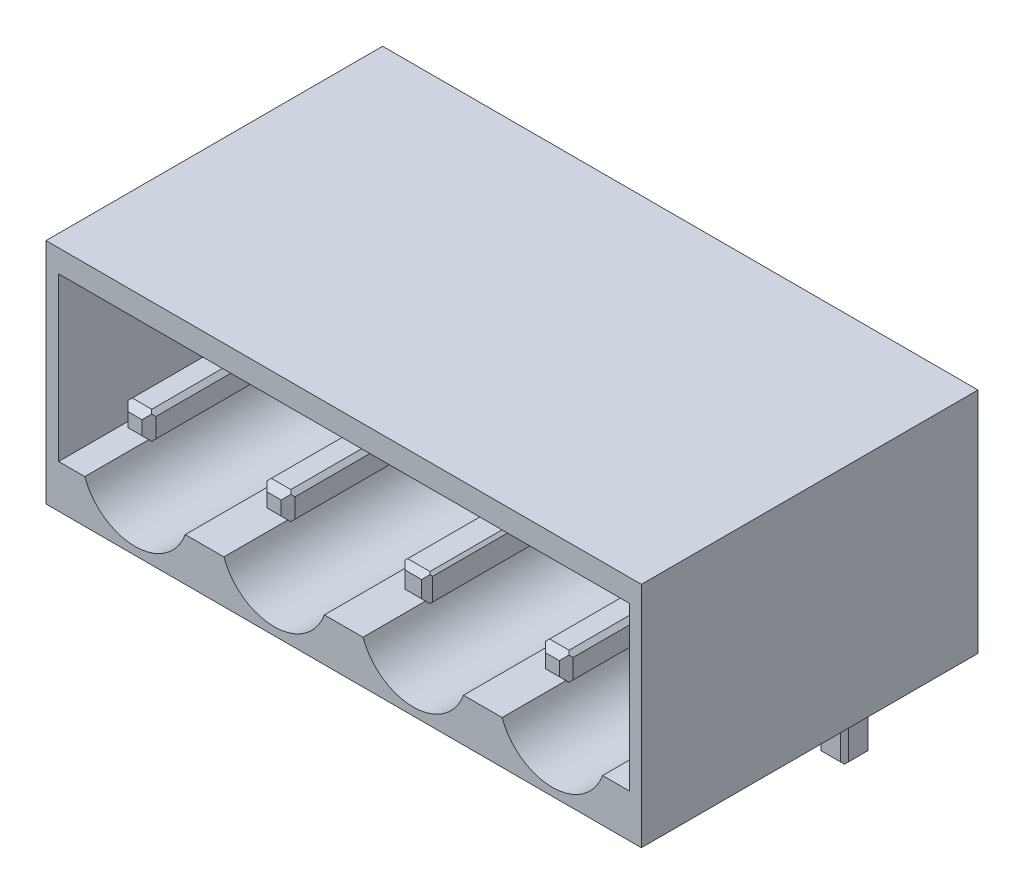
from build123d import *

# Parameters (mm, degrees)
SKETCH_1_W          = 21.4
SKETCH_1_H          = 8.2
EXTRUDE_1_DEPTH     = 12.1
SKETCH_4_R          = 1.25
CUT_EXTRUDE_3_DEPTH = 8
CUT_EXTRUDE_4_DEPTH = 7.8
SKETCH_7_W          = 1
SKETCH_7_H          = 1
EXTRUDE_2_DEPTH     = 8
CHAMFER_1_SIZE      = 0.15
CHAMFER_2_SIZE      = 0.25
SKETCH_8_W          = 1
SKETCH_8_H          = 1
EXTRUDE_3_DEPTH     = 4
CHAMFER_3_SIZE      = 0.15
CHAMFER_4_SIZE      = 0.25
CHAMFER_6_SIZE      = 0.1
CHAMFER_7_SIZE      = 0.2
CHAMFER_8_SIZE      = 0.1
CHAMFER_9_SIZE      = 0.2


with BuildPart() as part:
    # Эскиз1 → Бобышка-Вытянуть1 (new body)
    with BuildSketch(Plane.XY):
        Rectangle(SKETCH_1_W, SKETCH_1_H)
    extrude(amount=EXTRUDE_1_DEPTH)

    # Эскиз4 → Вырез-Вытянуть3 (cut)
    with BuildSketch(Plane.XY.offset(12.1)):
        with Locations((-7.5, 0)):
            Circle(SKETCH_4_R)
        with Locations((-2.5, 0)):
            Circle(SKETCH_4_R)
        with Locations((2.5, 0)):
            Circle(SKETCH_4_R)
        with Locations((7.5, 0)):
            Circle(SKETCH_4_R)
    extrude(amount=-CUT_EXTRUDE_3_DEPTH, mode=Mode.SUBTRACT)

    # Эскиз5 → Вырез-Вытянуть4 (cut)
    with BuildSketch(Plane.XY.offset(12.1)):
        with BuildLine():
            Line((-10.245621634, 0), (-10.245621634, 3.292901982))
            Line((-10.245621634, 3.292901982), (0.278509544, 3.292901982))
            Line((0.278509544, 3.292901982), (5.278509544, 3.292901982))
            Line((5.278509544, 3.292901982), (10.278509544, 3.292901982))
            Line((10.278509544, 3.292901982), (10.278509544, -2.548957219))
            Line((10.278509544, -2.548957219), (9.30582632, -2.548957219))
            ThreePointArc((9.30582632, -2.548957219), (7.5, -3.818893996), (5.69417368, -2.548957219))
            Line((5.69417368, -2.548957219), (4.30582632, -2.548957219))
            ThreePointArc((4.30582632, -2.548957219), (2.5, -3.818893996), (0.69417368, -2.548957219))
            Line((0.69417368, -2.548957219), (-0.69417368, -2.548957219))
            ThreePointArc((-0.69417368, -2.548957219), (-2.5, -3.818893996), (-4.30582632, -2.548957219))
            Line((-4.30582632, -2.548957219), (-5.69417368, -2.548957219))
            ThreePointArc((-5.69417368, -2.548957219), (-7.5, -3.818893996), (-9.30582632, -2.548957219))
            Line((-9.30582632, -2.548957219), (-10.245621634, -2.548957219))
            Line((-10.245621634, -2.548957219), (-10.245621634, 0))
        make_face()
    extrude(amount=-CUT_EXTRUDE_4_DEPTH, mode=Mode.SUBTRACT)

    # Эскиз7 → Бобышка-Вытянуть2 (add)
    with BuildSketch(Plane.XY.offset(4.1)):
        with Locations((-2.5, 0)):
            Rectangle(SKETCH_7_W, SKETCH_7_H)
        with Locations((-7.5, 0)):
            Rectangle(SKETCH_7_W, SKETCH_7_H)
        with Locations((2.5, 0)):
            Rectangle(SKETCH_7_W, SKETCH_7_H)
        with Locations((7.5, 0)):
            Rectangle(SKETCH_7_W, SKETCH_7_H)
    extrude(amount=EXTRUDE_2_DEPTH)

    # Фаска1
    chamfer_1_edges = [part.edges().sort_by_distance(p)[0] for p in [
        (-7, -0.5, 8.1),
        (-7, 0.5, 8.1),
        (-8, 0.5, 8.1),
        (-8, -0.5, 8.1),
        (-2, -0.5, 8.1),
        (-2, 0.5, 8.1),
        (-3, 0.5, 8.1),
        (-3, -0.5, 8.1),
    ]]
    chamfer(chamfer_1_edges, length=CHAMFER_1_SIZE)

    # Фаска2
    # the kernel refuses this chamfer: 0.25 mm, written as the material it takes off along each edge
    with BuildSketch(Plane(origin=(-3, -0.992920747, 12.1), x_dir=(-0.02749587661058555, 0, -0.9996219169112968), z_dir=(0, 1, 0)), Plane(origin=(-3.492920747, 0.5, 12.1), x_dir=(0, 0.027495876610586414, -0.9996219169112968), z_dir=(1, 0, 0)), Plane(origin=(-2, 0.992920747, 12.1), x_dir=(0.027495876610586414, 0, -0.9996219169112968), z_dir=(0, -1, 0)), Plane(origin=(-1.507079253, -0.5, 12.1), x_dir=(0, -0.027495876610586414, -0.9996219169112968), z_dir=(-1, 0, 0)), Plane(origin=(-7, 0.992920747, 12.1), x_dir=(0.02749587661058555, 0, -0.9996219169112968), z_dir=(0, -1, 0)), Plane(origin=(-6.507079253, -0.5, 12.1), x_dir=(0, -0.027495876610586414, -0.9996219169112968), z_dir=(-1, 0, 0)), Plane(origin=(-8, -0.992920747, 12.1), x_dir=(-0.027495876610589005, 0, -0.9996219169112968), z_dir=(0, 1, 0)), Plane(origin=(-8.492920747, 0.5, 12.1), x_dir=(0, 0.027495876610586414, -0.9996219169112968), z_dir=(1, 0, 0))) as chamfer_2_piece_1:
        Polygon((CHAMFER_2_SIZE * 0.999621916911, -CHAMFER_2_SIZE * 0.0274958766106), (-CHAMFER_2_SIZE * 0.0274958766106, -CHAMFER_2_SIZE * 0.999621916911), (0, 0), align=None)
    extrude(amount=1.985841494, mode=Mode.SUBTRACT)

    # Эскиз8 → Бобышка-Вытянуть3 (add)
    with BuildSketch(Plane(origin=(0, -4.1, 0), x_dir=(-1, 0, 0), z_dir=(0, -1, 0))):
        with Locations((2.5, -1.6)):
            Rectangle(SKETCH_8_W, SKETCH_8_H)
        with Locations((7.5, -1.6)):
            Rectangle(SKETCH_8_W, SKETCH_8_H)
        with Locations((-2.5, -1.6)):
            Rectangle(SKETCH_8_W, SKETCH_8_H)
        with Locations((-7.5, -1.6)):
            Rectangle(SKETCH_8_W, SKETCH_8_H)
    extrude(amount=EXTRUDE_3_DEPTH)

    # Фаска3
    chamfer_3_edges = [part.edges().sort_by_distance(p)[0] for p in [
        (8, -0.5, 8.1),
        (8, 0.5, 8.1),
        (7, 0.5, 8.1),
        (7, -0.5, 8.1),
        (-7, -6.1, 1.1),
        (-7, -6.1, 2.1),
        (-8, -6.1, 2.1),
        (-8, -6.1, 1.1),
        (-2, -6.1, 1.1),
        (-2, -6.1, 2.1),
        (-3, -6.1, 2.1),
        (-3, -6.1, 1.1),
        (8, -6.1, 1.1),
        (8, -6.1, 2.1),
        (7, -6.1, 2.1),
        (7, -6.1, 1.1),
    ]]
    chamfer(chamfer_3_edges, length=CHAMFER_3_SIZE)

    # Фаска4
    # the kernel refuses this chamfer: 0.25 mm, written as the material it takes off along each edge
    with BuildSketch(Plane(origin=(-2, -8.1, 2.592920747), x_dir=(0.02749587661058651, 0.9996219169112968, 0), z_dir=(0, 0, -1)), Plane(origin=(-3, -8.1, 0.607079253), x_dir=(-0.027495876610585647, 0.9996219169112968, 0), z_dir=(0, 0, 1)), Plane(origin=(-3.492920747, -8.1, 2.1), x_dir=(0, 0.9996219169112968, 0.027495876610585647), z_dir=(1, 0, 0)), Plane(origin=(-1.507079253, -8.1, 1.1), x_dir=(0, 0.9996219169112968, -0.02749587661058651), z_dir=(-1, 0, 0)), Plane(origin=(-8, -8.1, 0.607079253), x_dir=(-0.0274958766105891, 0.9996219169112968, 0), z_dir=(0, 0, 1)), Plane(origin=(-8.492920747, -8.1, 2.1), x_dir=(0, 0.9996219169112968, 0.027495876610585647), z_dir=(1, 0, 0)), Plane(origin=(-7, -8.1, 2.592920747), x_dir=(0.027495876610585647, 0.9996219169112968, 0), z_dir=(0, 0, -1)), Plane(origin=(-6.507079253, -8.1, 1.1), x_dir=(0, 0.9996219169112968, -0.02749587661058651), z_dir=(-1, 0, 0)), Plane(origin=(8.492920747, -8.1, 1.1), x_dir=(0, 0.9996219169112968, -0.02749587661058651), z_dir=(-1, 0, 0)), Plane(origin=(7, -8.1, 0.607079253), x_dir=(-0.027495876610585647, 0.9996219169112968, 0), z_dir=(0, 0, 1)), Plane(origin=(6.507079253, -8.1, 2.1), x_dir=(0, 0.9996219169112968, 0.027495876610585647), z_dir=(1, 0, 0)), Plane(origin=(8, -8.1, 2.592920747), x_dir=(0.0274958766105891, 0.9996219169112968, 0), z_dir=(0, 0, -1)), Plane(origin=(8.492920747, -0.5, 12.1), x_dir=(0, -0.027495876610586414, -0.9996219169112968), z_dir=(-1, 0, 0)), Plane(origin=(7, -0.992920747, 12.1), x_dir=(-0.02749587661058555, 0, -0.9996219169112968), z_dir=(0, 1, 0)), Plane(origin=(8, 0.992920747, 12.1), x_dir=(0.027495876610589005, 0, -0.9996219169112968), z_dir=(0, -1, 0)), Plane(origin=(6.507079253, 0.5, 12.1), x_dir=(0, 0.027495876610586414, -0.9996219169112968), z_dir=(1, 0, 0))) as chamfer_4_piece_1:
        Polygon((CHAMFER_4_SIZE * 0.999621916911, -CHAMFER_4_SIZE * 0.0274958766106), (-CHAMFER_4_SIZE * 0.0274958766106, -CHAMFER_4_SIZE * 0.999621916911), (0, 0), align=None)
    extrude(amount=1.985841494, mode=Mode.SUBTRACT)

    # Фаска6
    chamfer_6_edges = [part.edges().sort_by_distance(p)[0] for p in [
        (3, -0.5, 8.1),
        (3, 0.5, 8.1),
        (2, 0.5, 8.1),
        (2, -0.5, 8.1),
    ]]
    chamfer(chamfer_6_edges, length=CHAMFER_6_SIZE)

    # Фаска7
    # the kernel refuses this chamfer: 0.2 mm, written as the material it takes off along each edge
    with BuildSketch(Plane(origin=(3, 0.914336598, 12.1), x_dir=(0.02749587661058742, 0, -0.9996219169112966), z_dir=(0, -1, 0)), Plane(origin=(3.414336598, -0.5, 12.1), x_dir=(0, -0.02749587661058634, -0.9996219169112966), z_dir=(-1, 0, 0)), Plane(origin=(2, -0.914336598, 12.1), x_dir=(-0.02749587661058634, 0, -0.9996219169112966), z_dir=(0, 1, 0)), Plane(origin=(1.585663402, 0.5, 12.1), x_dir=(0, 0.02749587661058634, -0.9996219169112966), z_dir=(1, 0, 0))) as chamfer_7_piece_1:
        Polygon((CHAMFER_7_SIZE * 0.999621916911, -CHAMFER_7_SIZE * 0.0274958766106), (-CHAMFER_7_SIZE * 0.0274958766106, -CHAMFER_7_SIZE * 0.999621916911), (0, 0), align=None)
    extrude(amount=1.828673195, mode=Mode.SUBTRACT)

    # Фаска8
    chamfer_8_edges = [part.edges().sort_by_distance(p)[0] for p in [
        (3, -6.1, 1.1),
        (3, -6.1, 2.1),
        (2, -6.1, 2.1),
        (2, -6.1, 1.1),
    ]]
    chamfer(chamfer_8_edges, length=CHAMFER_8_SIZE)

    # Фаска9
    # the kernel refuses this chamfer: 0.2 mm, written as the material it takes off along each edge
    with BuildSketch(Plane(origin=(3, -8.1, 2.514336598), x_dir=(0.027495876610587302, 0.9996219169112966, 0), z_dir=(0, 0, -1)), Plane(origin=(3.414336598, -8.1, 1.1), x_dir=(0, 0.9996219169112968, -0.027495876610586226), z_dir=(-1, 0, 0)), Plane(origin=(2, -8.1, 0.685663402), x_dir=(-0.027495876610586223, 0.9996219169112966, 0), z_dir=(0, 0, 1)), Plane(origin=(1.585663402, -8.1, 2.1), x_dir=(0, 0.9996219169112966, 0.027495876610587302), z_dir=(1, 0, 0))) as chamfer_9_piece_1:
        Polygon((CHAMFER_9_SIZE * 0.999621916911, -CHAMFER_9_SIZE * 0.0274958766106), (-CHAMFER_9_SIZE * 0.0274958766106, -CHAMFER_9_SIZE * 0.999621916911), (0, 0), align=None)
    extrude(amount=1.828673195, mode=Mode.SUBTRACT)


solid = part.part
